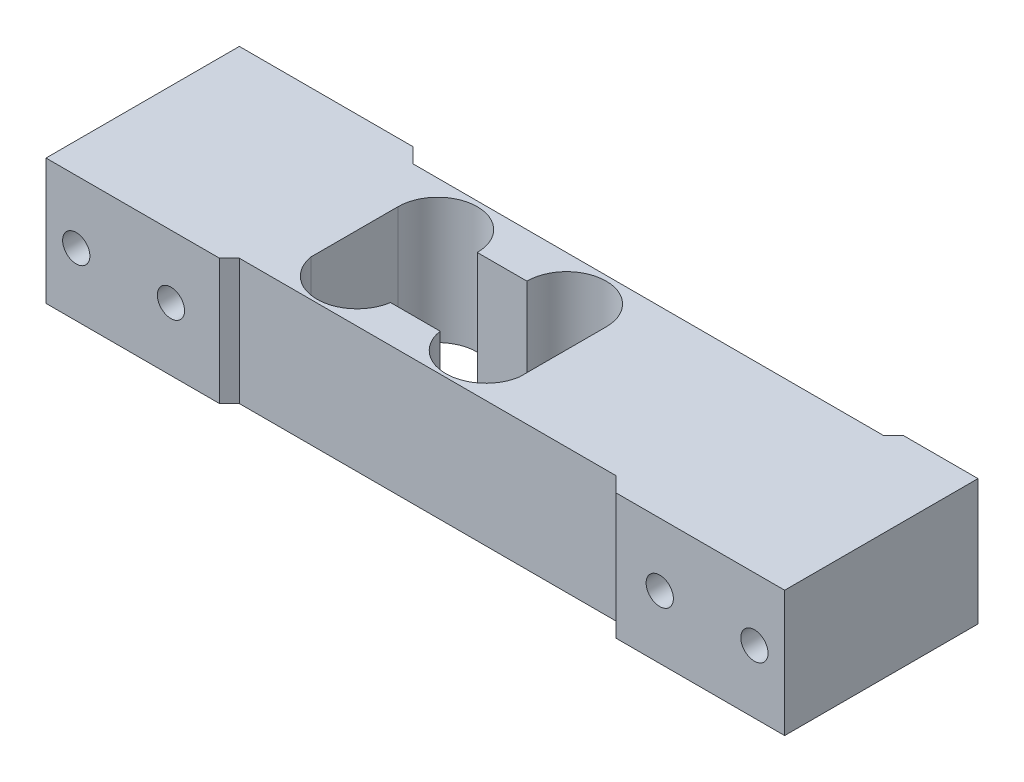
from build123d import *

# Parameters (mm, degrees)
CROQUIS1_W              = 150
CROQUIS1_H              = 40
SALIENTE_EXTRUIR1_DEPTH = 25.4
CORTAR_EXTRUIR1_DEPTH   = 82.671047502
CHAFL_N1_SIZE           = 5
CHAFL_N2_SIZE           = 3
CORTAR_EXTRUIR2_DEPTH   = 82.671047502
CROQUIS5_R              = 2.75
CORTAR_EXTRUIR3_DEPTH   = 16
CROQUIS6_R              = 2.75
CORTAR_EXTRUIR4_DEPTH   = 16
CORTAR_EXTRUIR8_START   = -16
CROQUIS7_R              = 2.75
CORTAR_EXTRUIR8_DEPTH   = 16
CROQUIS8_R              = 2.75
CORTAR_EXTRUIR9_DEPTH   = 16


with BuildPart() as part:
    # Croquis1 → Saliente-Extruir1 (new body)
    with BuildSketch(Plane(origin=(0, 0, 0), x_dir=(1, 0, 0), z_dir=(0, 1, 0))):
        Rectangle(CROQUIS1_W, CROQUIS1_H)
    extrude(amount=SALIENTE_EXTRUIR1_DEPTH)

    # Croquis2 → Cortar-Extruir1 (cut, through all)
    with BuildSketch(Plane(origin=(0, 25.4, 0), x_dir=(1, 0, 0), z_dir=(0, 1, 0))):
        Polygon((-42, 20), (-42, 17), (61, 17), (61, 19), (75, 19), (75, 20), (60, 20), align=None)
        Polygon((43, -20), (43, -17), (-41, -17), (-41, -19), (-75, -19), (-75, -20), align=None)
    extrude(amount=-CORTAR_EXTRUIR1_DEPTH, mode=Mode.SUBTRACT)

    # Chaflán1
    # the kernel refuses this chamfer: 5 mm, written as the material it adds along each edge
    with BuildSketch(Plane(origin=(43, 25.4, 17), x_dir=(-0.9996219169112968, 0, -0.027495876610586317), z_dir=(0, -1, 0))) as chafl_n1_piece_1_section:
        Polygon((CHAFL_N1_SIZE * 0.999621916911, -CHAFL_N1_SIZE * 0.0274958766106), (-CHAFL_N1_SIZE * 0.0274958766106, -CHAFL_N1_SIZE * 0.999621916911), (0, 0), align=None)
    chafl_n1_piece_1 = extrude(amount=25.4, mode=Mode.PRIVATE)
    chafl_n1_piece_1 = split(chafl_n1_piece_1, bisect_by=Plane(origin=(41.124952702, 12.7, 20), z_dir=(0, 0, -1)), keep=Keep.TOP, mode=Mode.PRIVATE)
    add(chafl_n1_piece_1)
    with BuildSketch(Plane(origin=(-42, 25.4, -17), x_dir=(-0.027495876610586317, 0, -0.9996219169112968), z_dir=(0, -1, 0))) as chafl_n1_piece_2_section:
        Polygon((CHAFL_N1_SIZE * 0.999621916911, CHAFL_N1_SIZE * 0.0274958766106), (-CHAFL_N1_SIZE * 0.0274958766106, CHAFL_N1_SIZE * 0.999621916911), (0, 0), align=None)
    chafl_n1_piece_2 = extrude(amount=25.4, mode=Mode.PRIVATE)
    chafl_n1_piece_2 = split(chafl_n1_piece_2, bisect_by=Plane(origin=(-40.124952702, 12.7, -20), z_dir=(0, 0, 1)), keep=Keep.TOP, mode=Mode.PRIVATE)
    add(chafl_n1_piece_2)

    # Chaflán2
    # the kernel refuses this chamfer: 3 mm, written as the material it adds along each edge
    with BuildSketch(Plane(origin=(-41, 25.4, 17), x_dir=(-0.027495876610586768, 0, 0.9996219169112968), z_dir=(0, -1, 0))) as chafl_n2_piece_1_section:
        Polygon((CHAFL_N2_SIZE * 0.999621916911, -CHAFL_N2_SIZE * 0.0274958766106), (-CHAFL_N2_SIZE * 0.0274958766106, -CHAFL_N2_SIZE * 0.999621916911), (0, 0), align=None)
    chafl_n2_piece_1 = extrude(amount=25.4, mode=Mode.PRIVATE)
    chafl_n2_piece_1 = split(chafl_n2_piece_1, bisect_by=Plane(origin=(-39.907908995, 12.7, 19), z_dir=(0, 0, -1)), keep=Keep.TOP, mode=Mode.PRIVATE)
    add(chafl_n2_piece_1)
    with BuildSketch(Plane(origin=(61, 25.4, -17), x_dir=(0.027495876610586768, 0, -0.9996219169112968), z_dir=(0, -1, 0))) as chafl_n2_piece_2_section:
        Polygon((CHAFL_N2_SIZE * 0.999621916911, -CHAFL_N2_SIZE * 0.0274958766106), (-CHAFL_N2_SIZE * 0.0274958766106, -CHAFL_N2_SIZE * 0.999621916911), (0, 0), align=None)
    chafl_n2_piece_2 = extrude(amount=25.4, mode=Mode.PRIVATE)
    chafl_n2_piece_2 = split(chafl_n2_piece_2, bisect_by=Plane(origin=(59.907908995, 12.7, -19), z_dir=(0, 0, 1)), keep=Keep.TOP, mode=Mode.PRIVATE)
    add(chafl_n2_piece_2)

    # Croquis3 → Cortar-Extruir2 (cut, through all)
    with BuildSketch(Plane(origin=(0, 25.4, 0), x_dir=(1, 0, 0), z_dir=(0, 1, 0))):
        with BuildLine():
            Line((-15, 8), (-5, 8))
            ThreePointArc((-5, 8), (3, 16), (11, 8))
            Line((11, 8), (11, -9.5))
            ThreePointArc((11, -9.5), (3, -16.34938703), (-5, -9.5))
            Line((-5, -9.5), (-15, -9.5))
            ThreePointArc((-15, -9.5), (-23, -16.349387053), (-31, -9.5))
            Line((-31, -9.5), (-31, 8))
            ThreePointArc((-31, 8), (-23, 16), (-15, 8))
        make_face()
    extrude(amount=-CORTAR_EXTRUIR2_DEPTH, mode=Mode.SUBTRACT)

    # Croquis5 → Cortar-Extruir3 (cut)
    with BuildSketch(Plane(origin=(0, 0, -20), x_dir=(-1, 0, 0), z_dir=(0, 0, -1))):
        with Locations((68.9, 12.7)):
            Circle(CROQUIS5_R)
        with Locations((49.8, 12.7)):
            Circle(CROQUIS5_R)
    extrude(amount=-CORTAR_EXTRUIR3_DEPTH, mode=Mode.SUBTRACT)

    # Croquis6 → Cortar-Extruir4 (cut)
    with BuildSketch(Plane.ZY.offset(75)):
        with Locations((9.05, 12.7)):
            Circle(CROQUIS6_R)
        with Locations((-10.05, 12.7)):
            Circle(CROQUIS6_R)
    extrude(amount=-CORTAR_EXTRUIR4_DEPTH, mode=Mode.SUBTRACT)

    # Croquis7 → Cortar-Extruir8 (cut)
    with BuildSketch(Plane.XY.offset(19).offset(CORTAR_EXTRUIR8_START)):
        with Locations(Location((-68.9, 12.7, 0), (0, 0, 180))):
            Circle(CROQUIS7_R)
        with Locations(Location((-49.8, 12.7, 0), (0, 0, 180))):
            Circle(CROQUIS7_R)
    extrude(amount=CORTAR_EXTRUIR8_DEPTH, mode=Mode.SUBTRACT)

    # Croquis8 → Cortar-Extruir9 (cut)
    with BuildSketch(Plane.XY.offset(20)):
        with Locations((49.8, 12.7)):
            Circle(CROQUIS8_R)
        with Locations((68.9, 12.7)):
            Circle(CROQUIS8_R)
    extrude(amount=-CORTAR_EXTRUIR9_DEPTH, mode=Mode.SUBTRACT)


solid = part.part
